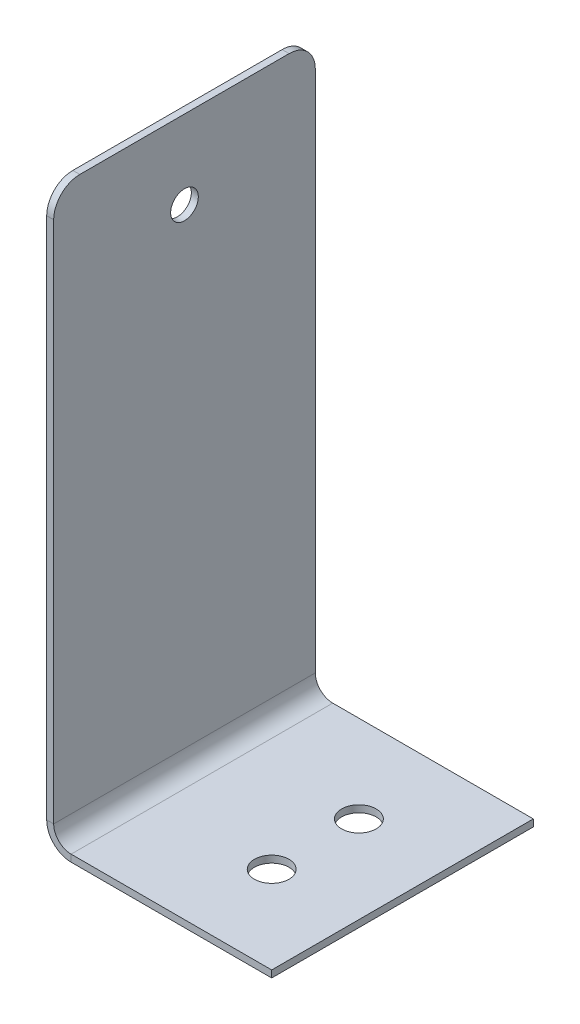
from build123d import *

# Parameters (mm, degrees)
BASE_FLANGE1_DEPTH      = 15
BASE_FLANGE1_DEPTH_BACK = 15
SKETCH2_R               = 1.5875
CUT_EXTRUDE1_DEPTH      = 72.239034244
SKETCH3_R               = 1.984375
CUT_EXTRUDE2_DEPTH      = 10
FILLET1_R               = 3


# Sheet-metal steps are written as plain solids
with BuildPart() as part:
    # Sketch1 → Base-Flange1 (new, two sides: drawn at the far end of the back side and taken through both)
    with BuildSketch(Plane.XY.offset(-BASE_FLANGE1_DEPTH_BACK)):
        with BuildLine():
            Line((25, 0), (2, 0))
            ThreePointArc((2, 0), (0.585786438, 0.585786438), (0, 2))
            Line((0, 2), (0, 65))
            Line((0, 65), (-0.8, 65))
            Line((-0.8, 65), (-0.8, 2))
            ThreePointArc((-0.8, 2), (0.020101013, 0.020101013), (2, -0.8))
            Line((2, -0.8), (25, -0.8))
            Line((25, -0.8), (25, 0))
        make_face()
    extrude(amount=BASE_FLANGE1_DEPTH + BASE_FLANGE1_DEPTH_BACK)

    # Sketch2 → Cut-Extrude1 (cut, through all)
    with BuildSketch(Plane(origin=(0, 0, 0), x_dir=(0, 0, -1), z_dir=(1, 0, 0))):
        with Locations((0, 55.99)):
            Circle(SKETCH2_R)
    extrude(amount=-CUT_EXTRUDE1_DEPTH, mode=Mode.SUBTRACT)

    # Sketch3 → Cut-Extrude2 (cut)
    with BuildSketch(Plane(origin=(0, 0, 0), x_dir=(1, 0, 0), z_dir=(0, 1, 0))):
        with Locations(Location((15, -5, 0), (0, 0, 270))):
            Circle(SKETCH3_R)
        with Locations(Location((15, 5, 0), (0, 0, 270))):
            Circle(SKETCH3_R)
    extrude(amount=-CUT_EXTRUDE2_DEPTH, mode=Mode.SUBTRACT)

    # Fillet1
    fillet1_edges = [part.edges().sort_by_distance(p)[0] for p in [
        (-0.4, 65, 15),
        (-0.4, 65, -15),
    ]]
    fillet(fillet1_edges, radius=FILLET1_R)


solid = part.part
